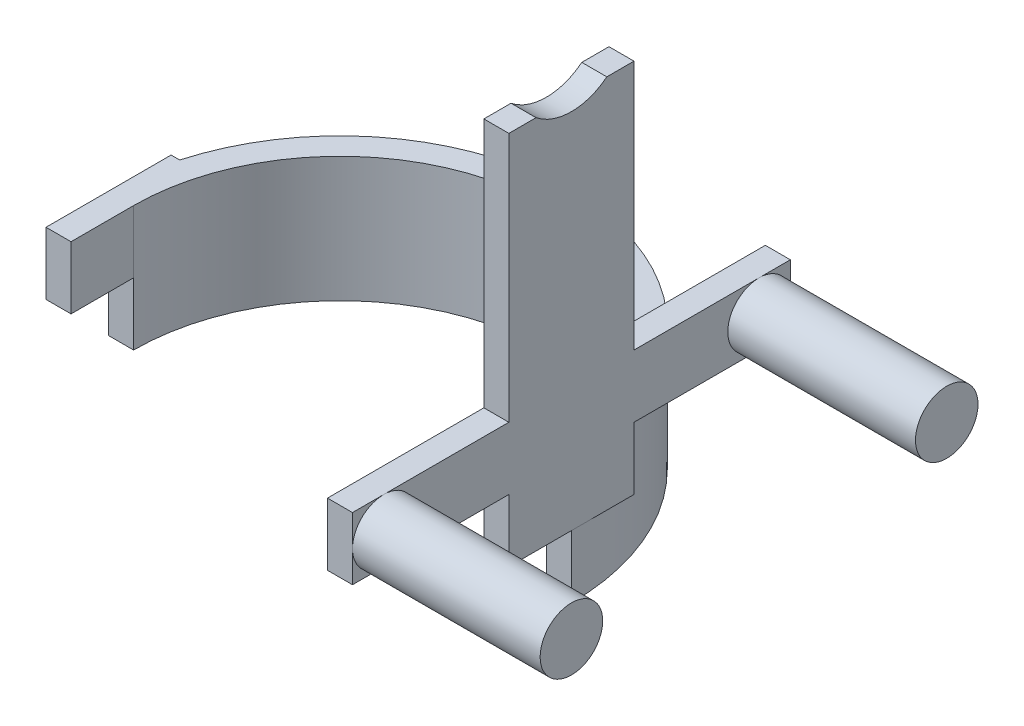
from build123d import *

# Parameters (mm, degrees)
EXTRUDE_1_DEPTH     = 40
SKETCH_2_W          = 8
SKETCH_2_H          = 40
EXTRUDE_2_DEPTH     = 100
SKETCH_3_R          = 18
CUT_EXTRUDE_1_DEPTH = 217.748702418
SKETCH_4_W          = 49.783903804
SKETCH_4_H          = 113.982309312
CUT_EXTRUDE_3_DEPTH = 10
SKETCH_5_R          = 84.762192866
CUT_EXTRUDE_4_DEPTH = 20
SKETCH_6_W          = 140
SKETCH_6_H          = 20
EXTRUDE_3_DEPTH     = 8
SKETCH_7_R          = 10
EXTRUDE_4_DEPTH     = 60


with BuildPart() as part:
    # 草图1 → 凸台-拉伸1 (new body)
    with BuildSketch(Plane(origin=(0, 0, 0), x_dir=(1, 0, 0), z_dir=(0, 1, 0))):
        with BuildLine():
            Line((-74, 20), (-71.246052522, 20))
            ThreePointArc((-71.246052522, 20), (0, 74), (71.246052522, 20))
            Line((71.246052522, 20), (74, 20))
            Line((74, 20), (74, -20))
            Line((74, -20), (66, -20))
            Line((66, -20), (66, 0))
            ThreePointArc((66, 0), (0, 66), (-66, 0))
            Line((-66, 0), (-66, -20))
            Line((-66, -20), (-74, -20))
            Line((-74, -20), (-74, 20))
        make_face()
    extrude(amount=EXTRUDE_1_DEPTH)

    # 草图2 → 凸台-拉伸2 (add)
    with BuildSketch(Plane(origin=(0, 40, 0), x_dir=(1, 0, 0), z_dir=(0, 1, 0))):
        with Locations((-70, 0)):
            Rectangle(SKETCH_2_W, SKETCH_2_H)
        with Locations((70, 0)):
            Rectangle(SKETCH_2_W, SKETCH_2_H)
    extrude(amount=EXTRUDE_2_DEPTH)

    # 草图3 → 切除-拉伸1 (cut, through all)
    with BuildSketch(Plane.ZY.offset(74)):
        with Locations((0, 154)):
            Circle(SKETCH_3_R)
    extrude(amount=-CUT_EXTRUDE_1_DEPTH, mode=Mode.SUBTRACT)

    # 草图4 → 切除-拉伸3 (cut)
    with BuildSketch(Plane.ZY.offset(74)):
        with Locations((4.891951902, 96.991154656)):
            Rectangle(SKETCH_4_W, SKETCH_4_H)
    extrude(amount=-CUT_EXTRUDE_3_DEPTH, mode=Mode.SUBTRACT)

    # 草图5 → 切除-拉伸4 (cut)
    with BuildSketch(Plane.XZ):
        Circle(SKETCH_5_R)
        with BuildLine():
            Line((-71.246052522, 20), (-66, 20))
            Line((-66, 20), (-66, 0))
            Line((-66, 0), (-74, 0))
            ThreePointArc((-74, 0), (0, -74), (74, 0))
            Line((74, 0), (66, 0))
            Line((66, 0), (66, 20))
            Line((66, 20), (71.246052522, 20))
            ThreePointArc((71.246052522, 20), (0, 74), (-71.246052522, 20))
        make_face(mode=Mode.SUBTRACT)
    extrude(amount=-CUT_EXTRUDE_4_DEPTH, mode=Mode.SUBTRACT)

    # 草图6 → 凸台-拉伸3 (add)
    with BuildSketch(Plane(origin=(74, 0, 0), x_dir=(0, 0, -1), z_dir=(1, 0, 0))):
        with Locations((0, 50)):
            Rectangle(SKETCH_6_W, SKETCH_6_H)
    extrude(amount=-EXTRUDE_3_DEPTH)

    # 草图7 → 凸台-拉伸4 (add)
    with BuildSketch(Plane(origin=(74, 0, 0), x_dir=(0, 0, -1), z_dir=(1, 0, 0))):
        with Locations((-60, 50)):
            Circle(SKETCH_7_R)
        with Locations((60, 50)):
            Circle(SKETCH_7_R)
    extrude(amount=EXTRUDE_4_DEPTH)


solid = part.part
